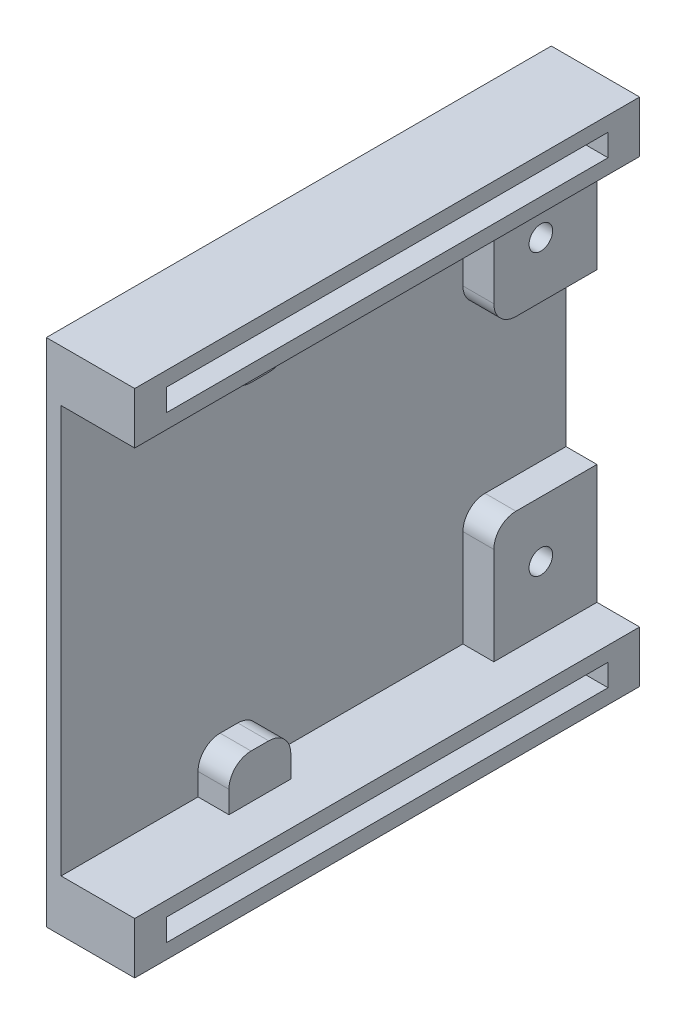
from build123d import *

# Parameters (mm, degrees)
SKETCH1_W               = 34.67
SKETCH1_H               = 34.29
BOSS_EXTRUDE1_DEPTH     = 1
SKETCH3_W               = 3.5
SKETCH3_H               = 34.29
BOSS_EXTRUDE2_DEPTH     = 5
CUT_EXTRUDE1_DEPTH      = 26.108828129
CUT_EXTRUDE1_DEPTH_BACK = 26.108828129
SKETCH5_W               = 1.5
SKETCH5_H               = 30
SKETCH6_W               = 3
SKETCH6_H               = 4.2
SKETCH6_W_2             = 8.11
SKETCH6_H_2             = 7
BOSS_EXTRUDE3_DEPTH     = 2.1
FILLET1_R               = 1.5
CUT_EXTRUDE2_DEPTH      = 25.577698224
CUT_EXTRUDE2_DEPTH_BACK = 25.577698224
SKETCH7_R               = 0.8


with BuildPart() as part:
    # Sketch1 → Boss-Extrude1 (new body)
    with BuildSketch(Plane.YZ):
        Rectangle(SKETCH1_W, SKETCH1_H)
    extrude(amount=BOSS_EXTRUDE1_DEPTH)

    # Sketch3 → Boss-Extrude2 (add)
    with BuildSketch(Plane.YZ.offset(1)):
        with Locations((-15.585, 0)):
            Rectangle(SKETCH3_W, SKETCH3_H)
        with Locations((15.585, 0)):
            Rectangle(SKETCH3_W, SKETCH3_H)
    extrude(amount=BOSS_EXTRUDE2_DEPTH)

    # Sketch5 → Cut-Extrude1 (cut, two sides: drawn at the far end of the back side and taken through both)
    with BuildSketch(Plane.YZ.offset(6).offset(-CUT_EXTRUDE1_DEPTH_BACK)):
        with Locations((-15.585, 0)):
            Rectangle(SKETCH5_W, SKETCH5_H)
        with Locations((15.585, 0)):
            Rectangle(SKETCH5_W, SKETCH5_H)
    extrude(amount=CUT_EXTRUDE1_DEPTH + CUT_EXTRUDE1_DEPTH_BACK, mode=Mode.SUBTRACT)

    # Sketch6 → Boss-Extrude3 (add)
    with BuildSketch(Plane.YZ.offset(1)):
        with Locations((-12.335, 5.745)):
            Rectangle(SKETCH6_W, SKETCH6_H)
        with Locations((-9.78, -13.645)):
            Rectangle(SKETCH6_W_2, SKETCH6_H_2)
        with Locations((9.78, -13.645)):
            Rectangle(SKETCH6_W_2, SKETCH6_H_2)
        with Locations((12.335, 5.745)):
            Rectangle(SKETCH6_W, SKETCH6_H)
    extrude(amount=BOSS_EXTRUDE3_DEPTH)

    # Fillet1
    fillet1_edges = [part.edges().sort_by_distance(p)[0] for p in [
        (2.05, 10.835, 3.645),
        (2.05, 10.835, 7.845),
        (2.05, -10.835, 3.645),
        (2.05, -10.835, 7.845),
        (2.05, 5.725, -10.145),
        (2.05, -5.725, -10.145),
    ]]
    fillet(fillet1_edges, radius=FILLET1_R)

    # Sketch7 → Cut-Extrude2 (cut, two sides: drawn at the far end of the back side and taken through both)
    with BuildSketch(Plane.YZ.offset(3.1).offset(-CUT_EXTRUDE2_DEPTH_BACK)):
        with Locations((-9.525, -13.335)):
            Circle(SKETCH7_R)
        with Locations((9.525, -13.335)):
            Circle(SKETCH7_R)
    extrude(amount=CUT_EXTRUDE2_DEPTH + CUT_EXTRUDE2_DEPTH_BACK, mode=Mode.SUBTRACT)


solid = part.part
